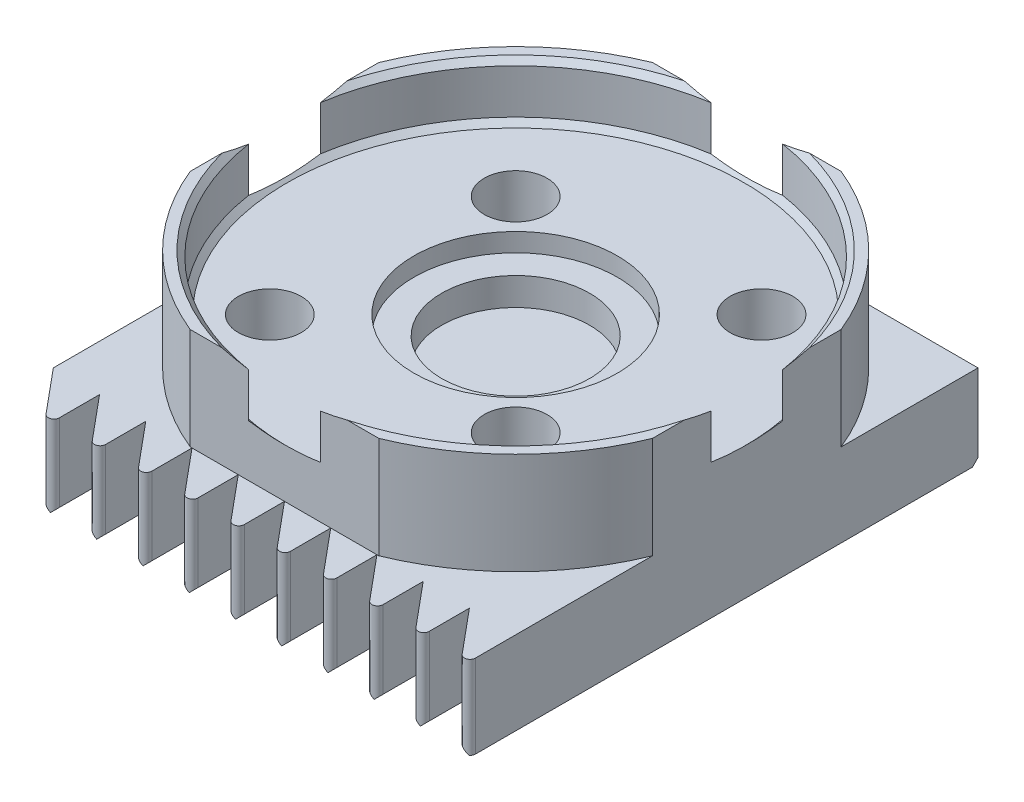
from build123d import *

# Parameters (mm, degrees)
SKETCH1_R           = 13.5
SKETCH1_R_2         = 1.7
SKETCH1_R_3         = 5.5
BOSS_EXTRUDE1_DEPTH = 2.5
SKETCH2_R           = 13.5
SKETCH2_R_2         = 12.65
BOSS_EXTRUDE2_DEPTH = 3
SKETCH3_W           = 25
SKETCH3_H           = 25
SKETCH3_R           = 3
BOSS_EXTRUDE3_DEPTH = 4.5
CHAMFER2_SIZE       = 0.3
SKETCH4_R           = 4
BOSS_EXTRUDE4_DEPTH = 1.5
CUT_EXTRUDE1_DEPTH  = 20.868316486
CHAMFER3_SIZE       = 0.3
BOSS_EXTRUDE5_DEPTH = 4.5
CHAMFER4_SIZE       = 0.3
FILLET1_R           = 0.3
SKETCH8_R           = 1.2
CUT_EXTRUDE2_DEPTH  = 3
CHAMFER5_SIZE       = 2


with BuildPart() as part:
    # Sketch1 → Boss-Extrude1 (new body)
    with BuildSketch(Plane(origin=(0, 0, 0), x_dir=(1, 0, 0), z_dir=(0, 1, 0))):
        with Locations(Location((0, 0, 0), (0, 0, 270))):
            Circle(SKETCH1_R)
        with Locations(Location((6.646803743, 6.646803743, 0), (0, 0, 270))):
            Circle(SKETCH1_R_2, mode=Mode.SUBTRACT)
        with Locations(Location((-6.646803743, -6.646803743, 0), (0, 0, 270))):
            Circle(SKETCH1_R_2, mode=Mode.SUBTRACT)
        with Locations(Location((5.533110563, -5.533110563, 0), (0, 0, 270))):
            Circle(SKETCH1_R_2, mode=Mode.SUBTRACT)
        with Locations(Location((-5.533110563, 5.533110563, 0), (0, 0, 270))):
            Circle(SKETCH1_R_2, mode=Mode.SUBTRACT)
        with Locations(Location((0, 0, 0), (0, 0, 270))):
            Circle(SKETCH1_R_3, mode=Mode.SUBTRACT)
    extrude(amount=BOSS_EXTRUDE1_DEPTH)

    # Sketch2 → Boss-Extrude2 (add)
    with BuildSketch(Plane(origin=(0, 2.5, 0), x_dir=(1, 0, 0), z_dir=(0, 1, 0))):
        with Locations(Location((0, 0, 0), (0, 0, 270))):
            Circle(SKETCH2_R)
        with Locations(Location((0, 0, 0), (0, 0, 270))):
            Circle(SKETCH2_R_2, mode=Mode.SUBTRACT)
    extrude(amount=BOSS_EXTRUDE2_DEPTH)

    # Sketch3 → Boss-Extrude3 (add)
    with BuildSketch(Plane.XZ):
        Rectangle(SKETCH3_W, SKETCH3_H)
        with Locations(Location((-6.646803743, 6.646803743, 0), (0, 0, 270))):
            Circle(SKETCH3_R, mode=Mode.SUBTRACT)
        with Locations(Location((5.533110563, 5.533110563, 0), (0, 0, 193.381478788))):
            Circle(SKETCH3_R, mode=Mode.SUBTRACT)
        with Locations(Location((6.646803743, -6.646803743, 0), (0, 0, 270))):
            Circle(SKETCH3_R, mode=Mode.SUBTRACT)
        with Locations(Location((-5.533110563, -5.533110563, 0), (0, 0, 76.618521212))):
            Circle(SKETCH3_R, mode=Mode.SUBTRACT)
    extrude(amount=BOSS_EXTRUDE3_DEPTH)

    # Chamfer2
    chamfer2_edges = [part.edges().sort_by_distance(p)[0] for p in [
        (0, 2.5, -12.65),
    ]]
    chamfer(chamfer2_edges, length=CHAMFER2_SIZE)

    # Sketch4 → Boss-Extrude4 (add)
    # profile 1 of 3: a face of its own
    with BuildSketch(Plane(origin=(0, 0, 0), x_dir=(1, 0, 0), z_dir=(0, 1, 0))):
        with BuildLine():
            ThreePointArc((-4.838810256, 2.614558339), (-3.889087297, -3.889087297), (2.614558339, -4.838810256))
            ThreePointArc((2.614558339, -4.838810256), (3.411790219, -3.411790219), (4.838810256, -2.614558339))
            ThreePointArc((4.838810256, -2.614558339), (3.889087297, 3.889087297), (-2.614558339, 4.838810256))
            ThreePointArc((-2.614558339, 4.838810256), (-3.411790219, 3.411790219), (-4.838810256, 2.614558339))
        make_face()
        with Locations(Location((0, 0, 0), (0, 0, 270))):
            Circle(SKETCH4_R, mode=Mode.SUBTRACT)
    # profile 2 of 3: a face of its own
    with BuildSketch(Plane(origin=(0, 0, 0), x_dir=(1, 0, 0), z_dir=(0, 1, 0))):
        with BuildLine():
            ThreePointArc((-4.838810256, 2.614558339), (-3.411790219, 3.411790219), (-2.614558339, 4.838810256))
            ThreePointArc((-2.614558339, 4.838810256), (-3.889087297, 3.889087297), (-4.838810256, 2.614558339))
        make_face()
    # profile 3 of 3: a face of its own
    with BuildSketch(Plane(origin=(0, 0, 0), x_dir=(1, 0, 0), z_dir=(0, 1, 0))):
        with BuildLine():
            ThreePointArc((2.614558339, -4.838810256), (3.889087297, -3.889087297), (4.838810256, -2.614558339))
            ThreePointArc((4.838810256, -2.614558339), (3.411790219, -3.411790219), (2.614558339, -4.838810256))
        make_face()
    extrude(amount=BOSS_EXTRUDE4_DEPTH)

    # Sketch6 → Cut-Extrude1 (cut, through all)
    with BuildSketch(Plane.XZ):
        with BuildLine():
            Line((5.099019514, -12.5), (-5.099019514, -12.5))
            ThreePointArc((-5.099019514, -12.5), (0, -13.5), (5.099019514, -12.5))
        make_face()
        with BuildLine():
            Line((12.5, 5.099019514), (12.5, -5.099019514))
            ThreePointArc((12.5, -5.099019514), (13.5, 0), (12.5, 5.099019514))
        make_face()
        with BuildLine():
            Line((-5.099019514, 12.5), (5.099019514, 12.5))
            ThreePointArc((5.099019514, 12.5), (0, 13.5), (-5.099019514, 12.5))
        make_face()
        with BuildLine():
            Line((-12.5, -5.099019514), (-12.5, 5.099019514))
            ThreePointArc((-12.5, 5.099019514), (-13.5, 0), (-12.5, -5.099019514))
        make_face()
    extrude(amount=-CUT_EXTRUDE1_DEPTH, mode=Mode.SUBTRACT)

    # Chamfer3
    chamfer3_edges = [part.edges().sort_by_distance(p)[0] for p in [
        (8.944900782, 5.5, -8.944900782),
        (-8.944900782, 5.5, -8.944900782),
        (-8.944900782, 5.5, 8.944900782),
        (8.944900782, 5.5, 8.944900782),
    ]]
    chamfer(chamfer3_edges, length=CHAMFER3_SIZE)

    # Sketch7 → Boss-Extrude5 (add)
    with BuildSketch(Plane.XZ.offset(4.5)):
        Polygon((-12.5, 12.5), (-10, 12.5), (-10, 15.5), align=None)
        Polygon((-10, 12.5), (-7.5, 12.5), (-7.5, 15.5), align=None)
        Polygon((-7.5, 12.5), (-5, 12.5), (-5, 15.5), align=None)
        Polygon((-5, 12.5), (-2.5, 12.5), (-2.5, 15.5), align=None)
        Polygon((-2.5, 12.5), (0, 12.5), (0, 15.5), align=None)
        Polygon((0, 12.5), (2.5, 12.5), (2.5, 15.5), align=None)
        Polygon((2.5, 12.5), (5, 12.5), (5, 15.5), align=None)
        Polygon((5, 12.5), (7.5, 12.5), (7.5, 15.5), align=None)
        Polygon((7.5, 12.5), (10, 12.5), (10, 15.5), align=None)
        Polygon((10, 12.5), (12.5, 12.5), (12.5, 15.5), align=None)
    extrude(amount=-BOSS_EXTRUDE5_DEPTH)

    # Chamfer4
    chamfer4_edges = [part.edges().sort_by_distance(p)[0] for p in [
        (-11.25, -4.5, 14),
        (-10, -4.5, 14),
        (-7.5, -4.5, 14),
        (-8.75, -4.5, 14),
        (-5, -4.5, 14),
        (-6.25, -4.5, 14),
        (-2.5, -4.5, 14),
        (-3.75, -4.5, 14),
        (0, -4.5, 14),
        (-1.25, -4.5, 14),
        (2.5, -4.5, 14),
        (1.25, -4.5, 14),
        (5, -4.5, 14),
        (3.75, -4.5, 14),
        (7.5, -4.5, 14),
        (6.25, -4.5, 14),
        (10, -4.5, 14),
        (8.75, -4.5, 14),
        (11.25, -4.5, 14),
        (0, -4.5, -12.5),
    ]]
    chamfer(chamfer4_edges, length=CHAMFER4_SIZE)

    # Fillet1
    fillet1_edges = [part.edges().sort_by_distance(p)[0] for p in [
        (10, -2.1, 15.5),
        (7.5, -2.1, 15.5),
        (5, -2.1, 15.5),
        (2.5, -2.1, 15.5),
        (0, -2.1, 15.5),
        (-2.5, -2.1, 15.5),
        (-5, -2.1, 15.5),
        (-7.5, -2.1, 15.5),
        (-10, -2.1, 15.5),
        (12.5, -2.1, 15.5),
    ]]
    fillet(fillet1_edges, radius=FILLET1_R)

    # Sketch8 → Cut-Extrude2 (cut)
    with BuildSketch(Plane.XZ.offset(4.5)):
        with Locations(Location((0, 6, 0), (0, 0, 270))):
            Circle(SKETCH8_R)
        with Locations(Location((0, -6, 0), (0, 0, 270))):
            Circle(SKETCH8_R)
    extrude(amount=-CUT_EXTRUDE2_DEPTH, mode=Mode.SUBTRACT)

    # Chamfer5
    # the kernel refuses this chamfer: 2 mm, written as the material it adds along each edge
    with BuildSketch(Plane(origin=(-5.533110563, 0, -5.533110563), x_dir=(0.2314334356248564, 0, 0.9728507413138335), z_dir=(0.9728507413138335, 0, -0.2314334356248564))) as chamfer5_piece_1_section:
        Polygon((3, CHAMFER5_SIZE), (3 - CHAMFER5_SIZE, 0), (3, 0), align=None)
    chamfer5_piece_1 = revolve(axis=Axis((-5.533110563, 0, -5.533110563), (0, -1, 0)), mode=Mode.PRIVATE)
    chamfer5_piece_1 = chamfer5_piece_1 - Plane(origin=(-5.533110563, -1.35638922, -5.533110563), x_dir=(0, 0, 1), z_dir=(0, -1, 0)) * Cylinder(1.7, 13, mode=Mode.PRIVATE)
    add(chamfer5_piece_1)
    with BuildSketch(Plane(origin=(5.533110563, 0, 5.533110563), x_dir=(-0.9728507413138336, 0, -0.23143343562485635), z_dir=(-0.23143343562485635, 0, 0.9728507413138336))) as chamfer5_piece_2_section:
        Polygon((3, CHAMFER5_SIZE), (3 - CHAMFER5_SIZE, 0), (3, 0), align=None)
    chamfer5_piece_2 = revolve(axis=Axis((5.533110563, 0, 5.533110563), (0, -1, 0)), mode=Mode.PRIVATE)
    chamfer5_piece_2 = chamfer5_piece_2 - Plane(origin=(5.533110563, -1.35638922, 5.533110563), x_dir=(0, 0, 1), z_dir=(0, -1, 0)) * Cylinder(1.7, 12, mode=Mode.PRIVATE)
    add(chamfer5_piece_2)
    with BuildSketch(Plane(origin=(6.646803743, 0, -6.646803743), x_dir=(0, 0, -1), z_dir=(-1, 0, 0))) as chamfer5_piece_3_section:
        Polygon((3, CHAMFER5_SIZE), (3 - CHAMFER5_SIZE, 0), (3, 0), align=None)
    chamfer5_piece_3 = revolve(axis=Axis((6.646803743, 0, -6.646803743), (0, -1, 0)), mode=Mode.PRIVATE)
    chamfer5_piece_3 = chamfer5_piece_3 - Plane(origin=(6.646803743, -1.35638922, -6.646803743), x_dir=(0, 0, 1), z_dir=(0, -1, 0)) * Cylinder(1.7, 13, mode=Mode.PRIVATE)
    add(chamfer5_piece_3)
    with BuildSketch(Plane(origin=(-6.646803743, 0, 6.646803743), x_dir=(0, 0, -1), z_dir=(-1, 0, 0))) as chamfer5_piece_4_section:
        Polygon((3, CHAMFER5_SIZE), (3 - CHAMFER5_SIZE, 0), (3, 0), align=None)
    chamfer5_piece_4 = revolve(axis=Axis((-6.646803743, 0, 6.646803743), (0, -1, 0)), mode=Mode.PRIVATE)
    chamfer5_piece_4 = chamfer5_piece_4 - Plane(origin=(-6.646803743, -1.35638922, 6.646803743), x_dir=(0, 0, 1), z_dir=(0, -1, 0)) * Cylinder(1.7, 13, mode=Mode.PRIVATE)
    add(chamfer5_piece_4)


solid = part.part
